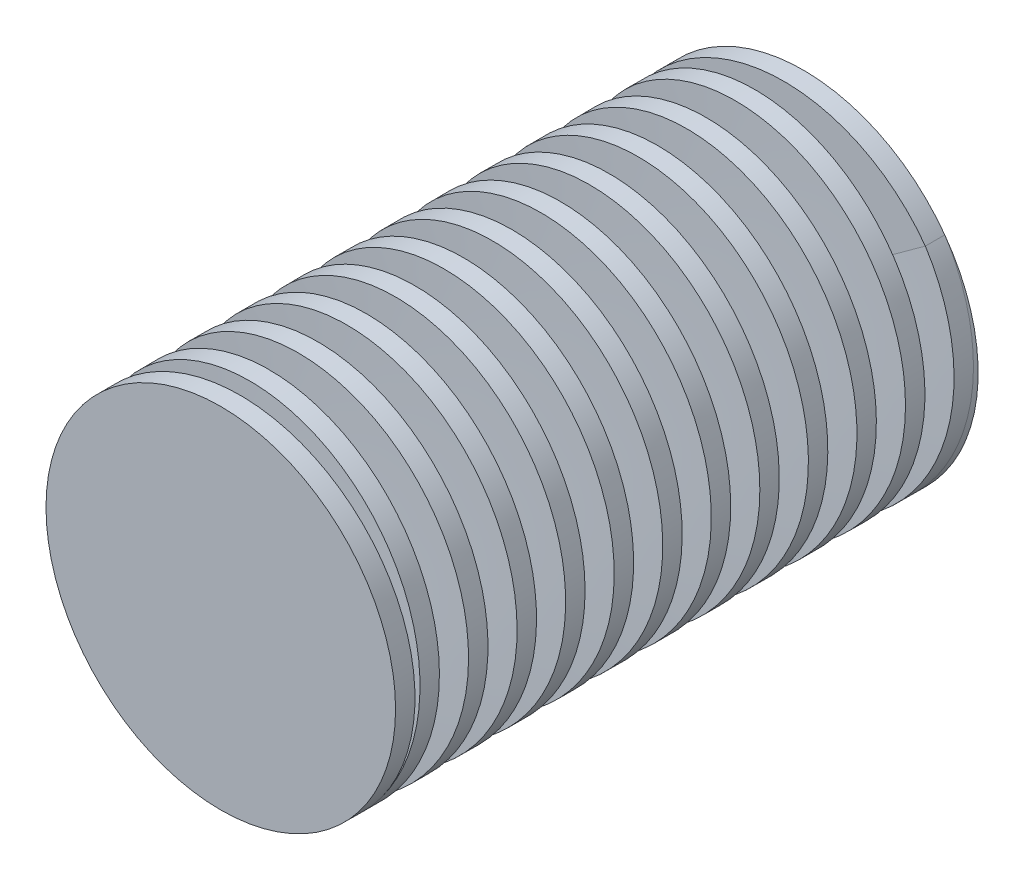
from build123d import *
from build123d.topology import SkipClean

# Parameters (mm, degrees)
SKETCH1_R           = 9
BOSS_EXTRUDE1_DEPTH = 1
SWEEP1_PITCH        = 2.5
SKETCH5_W           = 9
SKETCH5_H           = 1


with BuildPart() as part:
    # Sketch1 → Boss-Extrude1 (new body)
    with BuildSketch(Plane(origin=(0, 0, 0), x_dir=(0, 1, 0), z_dir=(0, 0, 1))):
        with Locations(Location((0, 0, 0), (0, 0, 270))):
            Circle(SKETCH1_R)
    extrude(amount=BOSS_EXTRUDE1_DEPTH)

    # Sweep1: the profile of Sketch3 profile screwed along a left-hand helix of 11.6 turns, 10 arcs to a turn; built about Z, then put on its axis
    with SkipClean():  # the faces are left unmerged after this step: merging them gives an invalid solid
        sweep1_z = Axis((0, 0, 0), (0, 0, 1))
        sweep1_corners = [(6, 0, -0.5), (9.0003, 0, -0.5), (9.0003, 0, 0.5), (6, 0, 0.5)]
        with BuildLine(mode=Mode.PRIVATE) as sweep1_profile:
            Line(sweep1_corners[0], sweep1_corners[1])
            Line(sweep1_corners[1], sweep1_corners[2])
            Line(sweep1_corners[2], sweep1_corners[3])
            Line(sweep1_corners[3], sweep1_corners[0])
        sweep1_cap = Face(sweep1_profile.wire())
        sweep1_turn_angles = [0, -18, -36, -54, -72, -90, -108, -126, -144, -162, -180, -198, -216, -234, -252, -270, -288, -306, -324, -342, -360]
        sweep1_turn_weights = [1, 0.9510565162951535, 1, 0.9510565162951535, 1, 0.9510565162951535, 1, 0.9510565162951535, 1, 0.9510565162951535, 1, 0.9510565162951535, 1, 0.9510565162951535, 1, 0.9510565162951535, 1, 0.9510565162951535, 1, 0.9510565162951535, 1]
        sweep1_turn_rails = [Edge.make_bspline([Vector(p[0], p[1], 0).rotate(sweep1_z, sweep1_turn_angles[k]) / sweep1_turn_weights[k] + Vector(0, 0, p[2] + -SWEEP1_PITCH * sweep1_turn_angles[k] / 360) for k in range(21)], [0, 0, 0, 1, 1, 2, 2, 3, 3, 4, 4, 5, 5, 6, 6, 7, 7, 8, 8, 9, 9, 10, 10, 10], 2, sweep1_turn_weights) for p in sweep1_corners]
        sweep1_turn_sides = [Face.make_surface_from_curves(sweep1_turn_rails[p[0]], sweep1_turn_rails[p[1]]) for p in [(0, 1), (1, 2), (2, 3), (3, 0)]]
        sweep1_last_angles = [-3960, -3978, -3996, -4014, -4032, -4050, -4068, -4086, -4104, -4122, -4140, -4158, -4176]
        sweep1_last_weights = [1, 0.9510565162951535, 1, 0.9510565162951535, 1, 0.9510565162951535, 1, 0.9510565162951535, 1, 0.9510565162951535, 1, 0.9510565162951781, 1]
        sweep1_last_rails = [Edge.make_bspline([Vector(p[0], p[1], 0).rotate(sweep1_z, sweep1_last_angles[k]) / sweep1_last_weights[k] + Vector(0, 0, p[2] + -SWEEP1_PITCH * sweep1_last_angles[k] / 360) for k in range(13)], [0, 0, 0, 1, 1, 2, 2, 3, 3, 4, 4, 5, 5, 6, 6, 6], 2, sweep1_last_weights) for p in sweep1_corners]
        sweep1_last_sides = [Face.make_surface_from_curves(sweep1_last_rails[p[0]], sweep1_last_rails[p[1]]) for p in [(0, 1), (1, 2), (2, 3), (3, 0)]]
        sweep1 = Plane(origin=(0, 0, 0.5), x_dir=(-1, 0, 0), z_dir=(0, 0, -1)) * Solid(Shell([*[p.moved(Location((0, 0, SWEEP1_PITCH * i))) for i in range(11) for p in sweep1_turn_sides], *sweep1_last_sides, sweep1_cap, sweep1_cap.rotate(sweep1_z, -4176).moved(Location((0, 0, -SWEEP1_PITCH * -4176 / 360)))]))
        add(sweep1)

    # Sketch5 → Revolve1 (revolve)
    with SkipClean():  # the faces are left unmerged after this step: merging them gives an invalid solid
        with BuildSketch(Plane(origin=(0, 0, 0), x_dir=(-1, 0, 0), z_dir=(0, 1, 0)), mode=Mode.PRIVATE) as revolve1_sk:
            with Locations((-4.5, -28.5)):
                Rectangle(SKETCH5_W, SKETCH5_H)
        revolve(revolve1_sk.sketch.rotate(Axis((0, 0, 7.022514485), (0, 0, -1)), 180), axis=Axis((0, 0, 7.022514485), (0, 0, -1)))


solid = part.part
